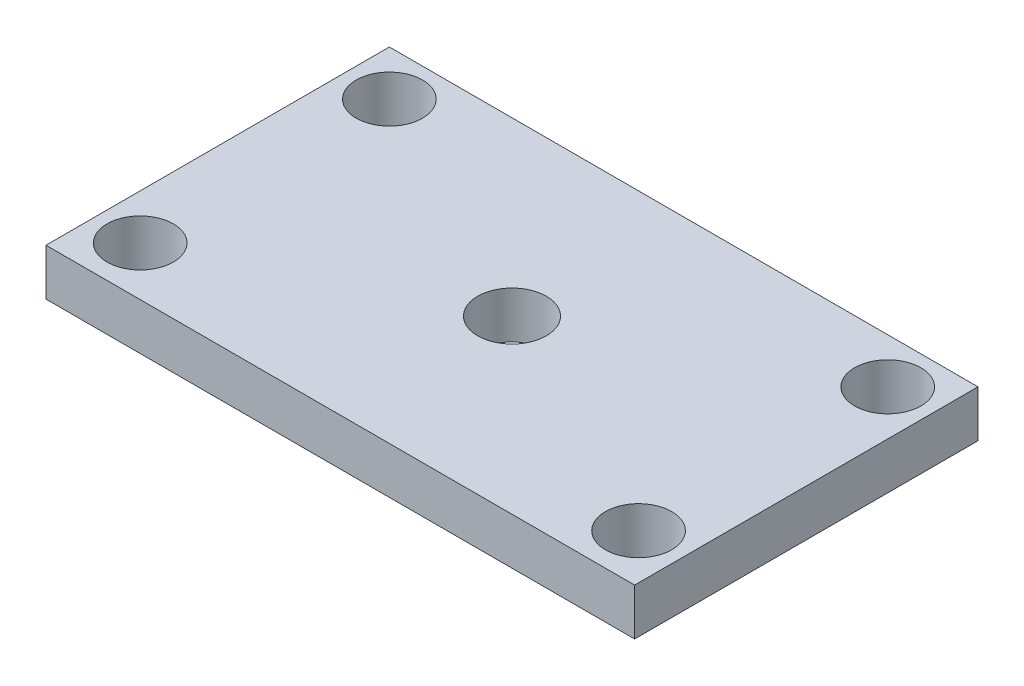
from build123d import *

# Parameters (mm, degrees)
SKETCH1_W           = 60
SKETCH1_H           = 35
SKETCH1_R           = 3.3782
SKETCH1_R_2         = 3.5
BOSS_EXTRUDE1_DEPTH = 4.7625


with BuildPart() as part:
    # Sketch1 → Boss-Extrude1 (new body)
    with BuildSketch(Plane(origin=(0, 0, 0), x_dir=(1, 0, 0), z_dir=(0, 1, 0))):
        with Locations((30, 17.5)):
            Rectangle(SKETCH1_W, SKETCH1_H)
        with Locations((4.6, 30.4)):
            Circle(SKETCH1_R, mode=Mode.SUBTRACT)
        with Locations((55.4, 30.4)):
            Circle(SKETCH1_R, mode=Mode.SUBTRACT)
        with Locations((4.6, 5)):
            Circle(SKETCH1_R, mode=Mode.SUBTRACT)
        with Locations((55.4, 5)):
            Circle(SKETCH1_R, mode=Mode.SUBTRACT)
        with Locations((30, 17.5)):
            Circle(SKETCH1_R_2, mode=Mode.SUBTRACT)
    extrude(amount=BOSS_EXTRUDE1_DEPTH)


solid = part.part
